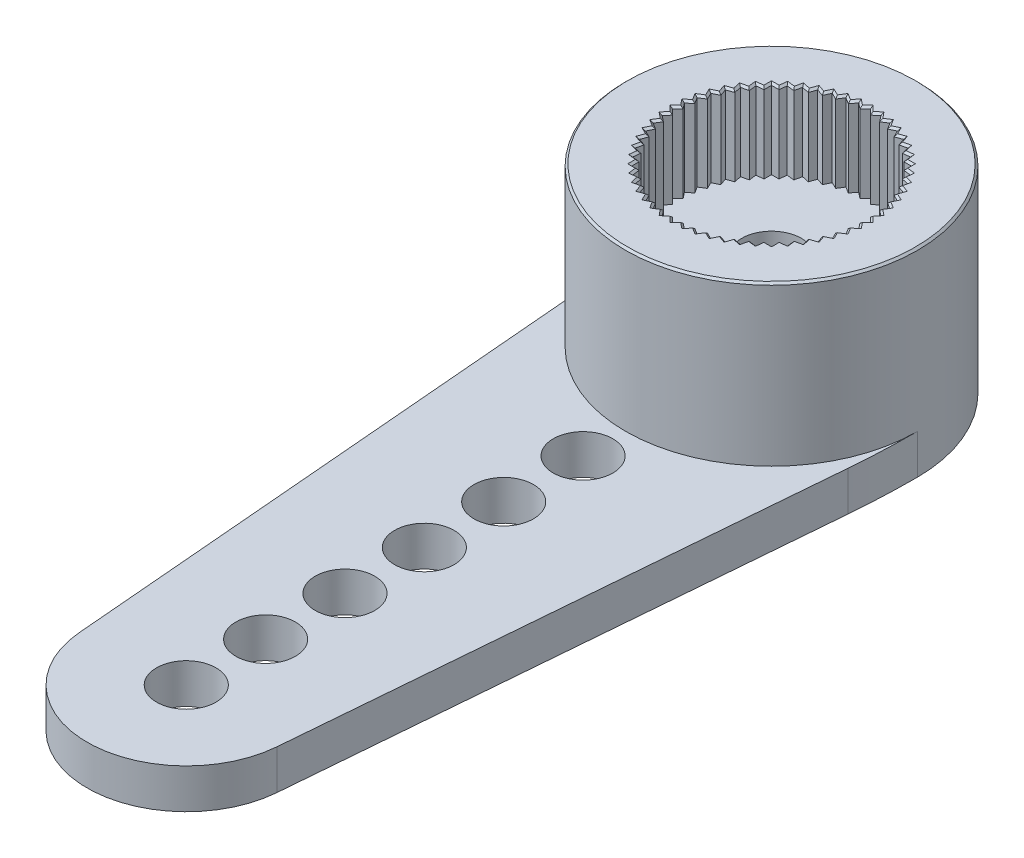
from build123d import *

# Parameters (mm, degrees)
SKETCH1_R           = 0.75
BOSS_EXTRUDE1_DEPTH = 1
SKETCH2_R           = 3.67931812
BOSS_EXTRUDE2_DEPTH = 5
SKETCH2_2_R         = 1.5
CUT_EXTRUDE1_DEPTH  = 0.5
SKETCH1_2_R         = 0.75
CUT_EXTRUDE4_DEPTH  = 19.333027078
SKETCH3_R           = 2.355
CUT_EXTRUDE5_DEPTH  = 2
CUT_EXTRUDE6_DEPTH  = 2
CIRPATTERN1_COUNT   = 56


with BuildPart() as part:
    # Sketch1 → Boss-Extrude1 (new body)
    with BuildSketch(Plane(origin=(0, 0, 0), x_dir=(1, 0, 0), z_dir=(0, 1, 0))):
        with BuildLine():
            Line((-3.608885156, -1.677008569), (-2.49119588, -14.959626071))
            ThreePointArc((-2.49119588, -14.959626071), (0, -17.25), (2.49119588, -14.959626071))
            Line((2.49119588, -14.959626071), (3.608885156, -1.677008569))
            ThreePointArc((3.608885156, -1.677008569), (3.661702121, -0.83924349), (3.67931812, 0))
            ThreePointArc((3.67931812, 0), (0, 3.67931812), (-3.67931812, 0))
            ThreePointArc((-3.67931812, 0), (-3.661702121, -0.83924349), (-3.608885156, -1.677008569))
        make_face()
        with Locations(Location((0, 0, 0), (0, 0, 270))):
            Circle(SKETCH1_R, mode=Mode.SUBTRACT)
        with Locations(Location((0, -4.75, 0), (0, 0, 90))):
            Circle(SKETCH1_R, mode=Mode.SUBTRACT)
        with Locations(Location((0, -6.75, 0), (0, 0, 90))):
            Circle(SKETCH1_R, mode=Mode.SUBTRACT)
        with Locations(Location((0, -8.75, 0), (0, 0, 90))):
            Circle(SKETCH1_R, mode=Mode.SUBTRACT)
        with Locations(Location((0, -10.75, 0), (0, 0, 90))):
            Circle(SKETCH1_R, mode=Mode.SUBTRACT)
        with Locations(Location((0, -12.75, 0), (0, 0, 90))):
            Circle(SKETCH1_R, mode=Mode.SUBTRACT)
        with Locations(Location((0, -14.75, 0), (0, 0, 90))):
            Circle(SKETCH1_R, mode=Mode.SUBTRACT)
    extrude(amount=BOSS_EXTRUDE1_DEPTH)

    # Sketch2 → Boss-Extrude2 (add)
    with BuildSketch(Plane.XZ):
        with Locations(Location((0, 0, 0), (0, 0, 270))):
            Circle(SKETCH2_R)
    extrude(amount=-BOSS_EXTRUDE2_DEPTH)

    # Sketch2<2> → Cut-Extrude1 (cut)
    with BuildSketch(Plane.XZ):
        with Locations(Location((0, 0, 0), (0, 0, 270))):
            Circle(SKETCH2_2_R)
    extrude(amount=-CUT_EXTRUDE1_DEPTH, mode=Mode.SUBTRACT)

    # Sketch1<2> → Cut-Extrude4 (cut, through all)
    with BuildSketch(Plane(origin=(0, 0, 0), x_dir=(1, 0, 0), z_dir=(0, 1, 0))):
        with Locations(Location((0, 0, 0), (0, 0, 90))):
            Circle(SKETCH1_2_R)
    extrude(amount=CUT_EXTRUDE4_DEPTH, mode=Mode.SUBTRACT)

    # Sketch3 → Cut-Extrude5 (cut)
    with BuildSketch(Plane(origin=(0, 5, 0), x_dir=(1, 0, 0), z_dir=(0, 1, 0))):
        with Locations(Location((0, 0, 0), (0, 0, 270))):
            Circle(SKETCH3_R)
    extrude(amount=-CUT_EXTRUDE5_DEPTH, mode=Mode.SUBTRACT)

    # Sketch4 → Cut-Extrude6 (cut)
    with BuildSketch(Plane(origin=(0, 5, 0), x_dir=(1, 0, 0), z_dir=(0, 1, 0))):
        with BuildLine():
            Line((0, 2.492171237), (-0.141421356, 2.35074988))
            ThreePointArc((-0.141421356, 2.35074988), (0, 2.355), (0.141421356, 2.35074988))
            Line((0.141421356, 2.35074988), (0, 2.492171237))
        make_face()
    cut_extrude6 = extrude(amount=-CUT_EXTRUDE6_DEPTH, mode=Mode.SUBTRACT)

    # CirPattern1: Cut-Extrude6 ×56 about axis
    cirpattern1_axis = Axis((0, 0, 0), (0, 1, 0))
    for i in range(1, CIRPATTERN1_COUNT):
        add(cut_extrude6.rotate(cirpattern1_axis, i * 360 / CIRPATTERN1_COUNT), mode=Mode.SUBTRACT)

    # Chamfer1: read off the stored shape, not the designer's step
    # Chamfer1 outline → Chamfer1 (revolve, cut)
    with BuildSketch(Plane.XY):
        Polygon((3.67931812, 5), (3.62931812, 5), (3.67931812, 4.95), align=None)
    revolve(axis=Axis((0, 0, 0), (0, 1, 0)), mode=Mode.SUBTRACT)

    # Chamfer1 2: loft between two sections, ruled curve by curve
    chamfer1_2_from = [
        Edge.make_line((0, 5, 2.562881915), (0.136275304, 5, 2.426606611)),
        Edge.make_line((2.426606611, 5, 0.136275304), (2.562881915, 5, 0)),
        Edge.make_line((0.136275304, 5, 2.426606611), (0.286951731, 5, 2.546767051)),
        Edge.make_line((-2.396090624, 5, 0.407112172), (-2.546767051, 5, 0.286951731)),
        Edge.make_line((0, 5, 2.562881915), (-0.136275304, 5, 2.426606611)),
        Edge.make_line((-2.426606611, 5, 0.136275304), (-2.562881915, 5, 0)),
        Edge.make_line((0.286951731, 5, 2.546767051), (0.407112172, 5, 2.396090624)),
        Edge.make_line((2.426606611, 5, -0.136275304), (2.546767051, 5, -0.286951731)),
        Edge.make_line((-0.136275304, 5, 2.426606611), (-0.286951731, 5, 2.546767051)),
        Edge.make_line((2.396090624, 5, 0.407112172), (2.546767051, 5, 0.286951731)),
        Edge.make_line((0.407112172, 5, 2.396090624), (0.570294877, 5, 2.498625114)),
        Edge.make_line((-2.335442409, 5, 0.672829367), (-2.498625114, 5, 0.570294877)),
        Edge.make_line((-0.286951731, 5, 2.546767051), (-0.407112172, 5, 2.396090624)),
        Edge.make_line((-2.426606611, 5, -0.136275304), (-2.546767051, 5, -0.286951731)),
        Edge.make_line((0.570294877, 5, 2.498625114), (0.672829367, 5, 2.335442409)),
        Edge.make_line((2.396090624, 5, -0.407112172), (2.498625114, 5, -0.570294877)),
        Edge.make_line((-0.407112172, 5, 2.396090624), (-0.570294877, 5, 2.498625114)),
        Edge.make_line((2.335442409, 5, 0.672829367), (2.498625114, 5, 0.570294877)),
        Edge.make_line((0.672829367, 5, 2.335442409), (0.846466235, 5, 2.419061517)),
        Edge.make_line((-2.245424649, 5, 0.930085343), (-2.419061517, 5, 0.846466235)),
        Edge.make_line((-0.570294877, 5, 2.498625114), (-0.672829367, 5, 2.335442409)),
        Edge.make_line((-2.396090624, 5, -0.407112172), (-2.498625114, 5, -0.570294877)),
        Edge.make_line((0.846466235, 5, 2.419061517), (0.930085343, 5, 2.245424649)),
        Edge.make_line((2.335442409, 5, -0.672829367), (2.419061517, 5, -0.846466235)),
        Edge.make_line((-0.672829367, 5, 2.335442409), (-0.846466235, 5, 2.419061517)),
        Edge.make_line((2.245424649, 5, 0.930085343), (2.419061517, 5, 0.846466235)),
        Edge.make_line((0.930085343, 5, 2.245424649), (1.111992788, 5, 2.309076817)),
        Edge.make_line((-2.127169372, 5, 1.175644956), (-2.309076817, 5, 1.111992788)),
        Edge.make_line((-0.846466235, 5, 2.419061517), (-0.930085343, 5, 2.245424649)),
        Edge.make_line((-2.335442409, 5, -0.672829367), (-2.419061517, 5, -0.846466235)),
        Edge.make_line((1.111992788, 5, 2.309076817), (1.175644956, 5, 2.127169372)),
        Edge.make_line((2.245424649, 5, -0.930085343), (2.309076817, 5, -1.111992788)),
        Edge.make_line((-0.930085343, 5, 2.245424649), (-1.111992788, 5, 2.309076817)),
        Edge.make_line((2.127169372, 5, 1.175644956), (2.309076817, 5, 1.111992788)),
        Edge.make_line((1.175644956, 5, 2.127169372), (1.363535387, 5, 2.170054137)),
        Edge.make_line((-1.982163706, 5, 1.406420152), (-2.170054137, 5, 1.363535387)),
        Edge.make_line((-1.111992788, 5, 2.309076817), (-1.175644956, 5, 2.127169372)),
        Edge.make_line((-2.245424649, 5, -0.930085343), (-2.309076817, 5, -1.111992788)),
        Edge.make_line((1.363535387, 5, 2.170054137), (1.406420152, 5, 1.982163706)),
        Edge.make_line((2.127169372, 5, -1.175644956), (2.170054137, 5, -1.363535387)),
        Edge.make_line((-1.175644956, 5, 2.127169372), (-1.363535387, 5, 2.170054137)),
        Edge.make_line((1.982163706, 5, 1.406420152), (2.170054137, 5, 1.363535387)),
        Edge.make_line((1.406420152, 5, 1.982163706), (1.597930737, 5, 2.003741767)),
        Edge.make_line((-1.812231181, 5, 1.619508798), (-2.003741767, 5, 1.597930737)),
        Edge.make_line((-1.363535387, 5, 2.170054137), (-1.406420152, 5, 1.982163706)),
        Edge.make_line((-2.127169372, 5, -1.175644956), (-2.170054137, 5, -1.363535387)),
        Edge.make_line((1.597930737, 5, 2.003741767), (1.619508798, 5, 1.812231181)),
        Edge.make_line((1.982163706, 5, -1.406420152), (2.003741767, 5, -1.597930737)),
        Edge.make_line((-1.406420152, 5, 1.982163706), (-1.597930737, 5, 2.003741767)),
        Edge.make_line((1.812231181, 5, 1.619508798), (2.003741767, 5, 1.597930737)),
        Edge.make_line((1.619508798, 5, 1.812231181), (1.812231181, 5, 1.812231181)),
        Edge.make_line((-1.619508798, 5, 1.812231181), (-1.812231181, 5, 1.812231181)),
        Edge.make_line((-1.597930737, 5, 2.003741767), (-1.619508798, 5, 1.812231181)),
        Edge.make_line((-1.982163706, 5, -1.406420152), (-2.003741767, 5, -1.597930737)),
        Edge.make_line((1.812231181, 5, 1.812231181), (1.812231181, 5, 1.619508798)),
        Edge.make_line((1.812231181, 5, -1.619508798), (1.812231181, 5, -1.812231181)),
        Edge.make_line((-1.812231181, 5, 1.812231181), (-1.812231181, 5, 1.619508798)),
        Edge.make_line((-1.812231181, 5, -1.619508798), (-1.812231181, 5, -1.812231181)),
        Edge.make_line((2.003741767, 5, 1.597930737), (1.982163706, 5, 1.406420152)),
        Edge.make_line((1.619508798, 5, -1.812231181), (1.597930737, 5, -2.003741767)),
        Edge.make_line((-2.003741767, 5, 1.597930737), (-1.982163706, 5, 1.406420152)),
        Edge.make_line((-1.619508798, 5, -1.812231181), (-1.597930737, 5, -2.003741767)),
        Edge.make_line((2.170054137, 5, 1.363535387), (2.127169372, 5, 1.175644956)),
        Edge.make_line((1.406420152, 5, -1.982163706), (1.363535387, 5, -2.170054137)),
        Edge.make_line((-2.170054137, 5, 1.363535387), (-2.127169372, 5, 1.175644956)),
        Edge.make_line((-1.406420152, 5, -1.982163706), (-1.363535387, 5, -2.170054137)),
        Edge.make_line((2.309076817, 5, 1.111992788), (2.245424649, 5, 0.930085343)),
        Edge.make_line((1.175644956, 5, -2.127169372), (1.111992788, 5, -2.309076817)),
        Edge.make_line((-2.309076817, 5, 1.111992788), (-2.245424649, 5, 0.930085343)),
        Edge.make_line((-1.175644956, 5, -2.127169372), (-1.111992788, 5, -2.309076817)),
        Edge.make_line((2.419061517, 5, 0.846466235), (2.335442409, 5, 0.672829367)),
        Edge.make_line((0.930085343, 5, -2.245424649), (0.846466235, 5, -2.419061517)),
        Edge.make_line((-2.419061517, 5, 0.846466235), (-2.335442409, 5, 0.672829367)),
        Edge.make_line((-0.930085343, 5, -2.245424649), (-0.846466235, 5, -2.419061517)),
        Edge.make_line((2.498625114, 5, 0.570294877), (2.396090624, 5, 0.407112172)),
        Edge.make_line((0.672829367, 5, -2.335442409), (0.570294877, 5, -2.498625114)),
        Edge.make_line((-2.498625114, 5, 0.570294877), (-2.396090624, 5, 0.407112172)),
        Edge.make_line((-0.672829367, 5, -2.335442409), (-0.570294877, 5, -2.498625114)),
        Edge.make_line((2.546767051, 5, 0.286951731), (2.426606611, 5, 0.136275304)),
        Edge.make_line((0.407112172, 5, -2.396090624), (0.286951731, 5, -2.546767051)),
        Edge.make_line((-2.546767051, 5, 0.286951731), (-2.426606611, 5, 0.136275304)),
        Edge.make_line((-0.407112172, 5, -2.396090624), (-0.286951731, 5, -2.546767051)),
        Edge.make_line((2.562881915, 5, 0), (2.426606611, 5, -0.136275304)),
        Edge.make_line((0.136275304, 5, -2.426606611), (0, 5, -2.562881915)),
        Edge.make_line((-2.562881915, 5, 0), (-2.426606611, 5, -0.136275304)),
        Edge.make_line((0, 5, -2.562881915), (-0.136275304, 5, -2.426606611)),
        Edge.make_line((2.546767051, 5, -0.286951731), (2.396090624, 5, -0.407112172)),
        Edge.make_line((-0.286951731, 5, -2.546767051), (-0.136275304, 5, -2.426606611)),
        Edge.make_line((-2.546767051, 5, -0.286951731), (-2.396090624, 5, -0.407112172)),
        Edge.make_line((0.286951731, 5, -2.546767051), (0.136275304, 5, -2.426606611)),
        Edge.make_line((2.498625114, 5, -0.570294877), (2.335442409, 5, -0.672829367)),
        Edge.make_line((-0.570294877, 5, -2.498625114), (-0.407112172, 5, -2.396090624)),
        Edge.make_line((-2.498625114, 5, -0.570294877), (-2.335442409, 5, -0.672829367)),
        Edge.make_line((0.570294877, 5, -2.498625114), (0.407112172, 5, -2.396090624)),
        Edge.make_line((2.419061517, 5, -0.846466235), (2.245424649, 5, -0.930085343)),
        Edge.make_line((-0.846466235, 5, -2.419061517), (-0.672829367, 5, -2.335442409)),
        Edge.make_line((-2.419061517, 5, -0.846466235), (-2.245424649, 5, -0.930085343)),
        Edge.make_line((0.846466235, 5, -2.419061517), (0.672829367, 5, -2.335442409)),
        Edge.make_line((2.309076817, 5, -1.111992788), (2.127169372, 5, -1.175644956)),
        Edge.make_line((-1.111992788, 5, -2.309076817), (-0.930085343, 5, -2.245424649)),
        Edge.make_line((-2.309076817, 5, -1.111992788), (-2.127169372, 5, -1.175644956)),
        Edge.make_line((1.111992788, 5, -2.309076817), (0.930085343, 5, -2.245424649)),
        Edge.make_line((2.170054137, 5, -1.363535387), (1.982163706, 5, -1.406420152)),
        Edge.make_line((-1.363535387, 5, -2.170054137), (-1.175644956, 5, -2.127169372)),
        Edge.make_line((-2.170054137, 5, -1.363535387), (-1.982163706, 5, -1.406420152)),
        Edge.make_line((1.363535387, 5, -2.170054137), (1.175644956, 5, -2.127169372)),
        Edge.make_line((2.003741767, 5, -1.597930737), (1.812231181, 5, -1.619508798)),
        Edge.make_line((-1.597930737, 5, -2.003741767), (-1.406420152, 5, -1.982163706)),
        Edge.make_line((-2.003741767, 5, -1.597930737), (-1.812231181, 5, -1.619508798)),
        Edge.make_line((1.597930737, 5, -2.003741767), (1.406420152, 5, -1.982163706)),
        Edge.make_line((1.812231181, 5, -1.812231181), (1.619508798, 5, -1.812231181)),
        Edge.make_line((-1.812231181, 5, -1.812231181), (-1.619508798, 5, -1.812231181)),
    ]
    chamfer1_2_to = [
        Edge.make_line((0, 4.95, 2.492171237), (0.132515428, 4.95, 2.359655809)),
        Edge.make_line((2.359655809, 4.95, 0.132515428), (2.492171237, 4.95, 0)),
        Edge.make_line((0.132515428, 4.95, 2.359655809), (0.279034647, 4.95, 2.476500987)),
        Edge.make_line((-2.329981768, 4.95, 0.395879825), (-2.476500987, 4.95, 0.279034647)),
        Edge.make_line((0, 4.95, 2.492171237), (-0.132515428, 4.95, 2.359655809)),
        Edge.make_line((-2.359655809, 4.95, 0.132515428), (-2.492171237, 4.95, 0)),
        Edge.make_line((0.279034647, 4.95, 2.476500987), (0.395879825, 4.95, 2.329981768)),
        Edge.make_line((2.359655809, 4.95, -0.132515428), (2.476500987, 4.95, -0.279034647)),
        Edge.make_line((-0.132515428, 4.95, 2.359655809), (-0.279034647, 4.95, 2.476500987)),
        Edge.make_line((2.329981768, 4.95, 0.395879825), (2.476500987, 4.95, 0.279034647)),
        Edge.make_line((0.395879825, 4.95, 2.329981768), (0.554560271, 4.95, 2.4296873)),
        Edge.make_line((-2.271006854, 4.95, 0.654265804), (-2.4296873, 4.95, 0.554560271)),
        Edge.make_line((-0.279034647, 4.95, 2.476500987), (-0.395879825, 4.95, 2.329981768)),
        Edge.make_line((-2.359655809, 4.95, -0.132515428), (-2.476500987, 4.95, -0.279034647)),
        Edge.make_line((0.554560271, 4.95, 2.4296873), (0.654265804, 4.95, 2.271006854)),
        Edge.make_line((2.329981768, 4.95, -0.395879825), (2.4296873, 4.95, -0.554560271)),
        Edge.make_line((-0.395879825, 4.95, 2.329981768), (-0.554560271, 4.95, 2.4296873)),
        Edge.make_line((2.271006854, 4.95, 0.654265804), (2.4296873, 4.95, 0.554560271)),
        Edge.make_line((0.654265804, 4.95, 2.271006854), (0.823111978, 4.95, 2.352318886)),
        Edge.make_line((-2.183472712, 4.95, 0.90442401), (-2.352318886, 4.95, 0.823111978)),
        Edge.make_line((-0.554560271, 4.95, 2.4296873), (-0.654265804, 4.95, 2.271006854)),
        Edge.make_line((-2.329981768, 4.95, -0.395879825), (-2.4296873, 4.95, -0.554560271)),
        Edge.make_line((0.823111978, 4.95, 2.352318886), (0.90442401, 4.95, 2.183472712)),
        Edge.make_line((2.271006854, 4.95, -0.654265804), (2.352318886, 4.95, -0.823111978)),
        Edge.make_line((-0.654265804, 4.95, 2.271006854), (-0.823111978, 4.95, 2.352318886)),
        Edge.make_line((2.183472712, 4.95, 0.90442401), (2.352318886, 4.95, 0.823111978)),
        Edge.make_line((0.90442401, 4.95, 2.183472712), (1.081312575, 4.95, 2.245368698)),
        Edge.make_line((-2.068480133, 4.95, 1.14320856), (-2.245368698, 4.95, 1.081312575)),
        Edge.make_line((-0.823111978, 4.95, 2.352318886), (-0.90442401, 4.95, 2.183472712)),
        Edge.make_line((-2.271006854, 4.95, -0.654265804), (-2.352318886, 4.95, -0.823111978)),
        Edge.make_line((1.081312575, 4.95, 2.245368698), (1.14320856, 4.95, 2.068480133)),
        Edge.make_line((2.183472712, 4.95, -0.90442401), (2.245368698, 4.95, -1.081312575)),
        Edge.make_line((-0.90442401, 4.95, 2.183472712), (-1.081312575, 4.95, 2.245368698)),
        Edge.make_line((2.068480133, 4.95, 1.14320856), (2.245368698, 4.95, 1.081312575)),
        Edge.make_line((1.14320856, 4.95, 2.068480133), (1.325915038, 4.95, 2.110181695)),
        Edge.make_line((-1.927475217, 4.95, 1.367616599), (-2.110181695, 4.95, 1.325915038)),
        Edge.make_line((-1.081312575, 4.95, 2.245368698), (-1.14320856, 4.95, 2.068480133)),
        Edge.make_line((-2.183472712, 4.95, -0.90442401), (-2.245368698, 4.95, -1.081312575)),
        Edge.make_line((1.325915038, 4.95, 2.110181695), (1.367616599, 4.95, 1.927475217)),
        Edge.make_line((2.068480133, 4.95, -1.14320856), (2.110181695, 4.95, -1.325915038)),
        Edge.make_line((-1.14320856, 4.95, 2.068480133), (-1.325915038, 4.95, 2.110181695)),
        Edge.make_line((1.927475217, 4.95, 1.367616599), (2.110181695, 4.95, 1.325915038)),
        Edge.make_line((1.367616599, 4.95, 1.927475217), (1.553843351, 4.95, 1.948457932)),
        Edge.make_line((-1.762231181, 4.95, 1.574826066), (-1.948457932, 4.95, 1.553843351)),
        Edge.make_line((-1.325915038, 4.95, 2.110181695), (-1.367616599, 4.95, 1.927475217)),
        Edge.make_line((-2.068480133, 4.95, -1.14320856), (-2.110181695, 4.95, -1.325915038)),
        Edge.make_line((1.553843351, 4.95, 1.948457932), (1.574826066, 4.95, 1.762231181)),
        Edge.make_line((1.927475217, 4.95, -1.367616599), (1.948457932, 4.95, -1.553843351)),
        Edge.make_line((-1.367616599, 4.95, 1.927475217), (-1.553843351, 4.95, 1.948457932)),
        Edge.make_line((1.762231181, 4.95, 1.574826066), (1.948457932, 4.95, 1.553843351)),
        Edge.make_line((1.574826066, 4.95, 1.762231181), (1.762231181, 4.95, 1.762231181)),
        Edge.make_line((-1.574826066, 4.95, 1.762231181), (-1.762231181, 4.95, 1.762231181)),
        Edge.make_line((-1.553843351, 4.95, 1.948457932), (-1.574826066, 4.95, 1.762231181)),
        Edge.make_line((-1.927475217, 4.95, -1.367616599), (-1.948457932, 4.95, -1.553843351)),
        Edge.make_line((1.762231181, 4.95, 1.762231181), (1.762231181, 4.95, 1.574826066)),
        Edge.make_line((1.762231181, 4.95, -1.574826066), (1.762231181, 4.95, -1.762231181)),
        Edge.make_line((-1.762231181, 4.95, 1.762231181), (-1.762231181, 4.95, 1.574826066)),
        Edge.make_line((-1.762231181, 4.95, -1.574826066), (-1.762231181, 4.95, -1.762231181)),
        Edge.make_line((1.948457932, 4.95, 1.553843351), (1.927475217, 4.95, 1.367616599)),
        Edge.make_line((1.574826066, 4.95, -1.762231181), (1.553843351, 4.95, -1.948457932)),
        Edge.make_line((-1.948457932, 4.95, 1.553843351), (-1.927475217, 4.95, 1.367616599)),
        Edge.make_line((-1.574826066, 4.95, -1.762231181), (-1.553843351, 4.95, -1.948457932)),
        Edge.make_line((2.110181695, 4.95, 1.325915038), (2.068480133, 4.95, 1.14320856)),
        Edge.make_line((1.367616599, 4.95, -1.927475217), (1.325915038, 4.95, -2.110181695)),
        Edge.make_line((-2.110181695, 4.95, 1.325915038), (-2.068480133, 4.95, 1.14320856)),
        Edge.make_line((-1.367616599, 4.95, -1.927475217), (-1.325915038, 4.95, -2.110181695)),
        Edge.make_line((2.245368698, 4.95, 1.081312575), (2.183472712, 4.95, 0.90442401)),
        Edge.make_line((1.14320856, 4.95, -2.068480133), (1.081312575, 4.95, -2.245368698)),
        Edge.make_line((-2.245368698, 4.95, 1.081312575), (-2.183472712, 4.95, 0.90442401)),
        Edge.make_line((-1.14320856, 4.95, -2.068480133), (-1.081312575, 4.95, -2.245368698)),
        Edge.make_line((2.352318886, 4.95, 0.823111978), (2.271006854, 4.95, 0.654265804)),
        Edge.make_line((0.90442401, 4.95, -2.183472712), (0.823111978, 4.95, -2.352318886)),
        Edge.make_line((-2.352318886, 4.95, 0.823111978), (-2.271006854, 4.95, 0.654265804)),
        Edge.make_line((-0.90442401, 4.95, -2.183472712), (-0.823111978, 4.95, -2.352318886)),
        Edge.make_line((2.4296873, 4.95, 0.554560271), (2.329981768, 4.95, 0.395879825)),
        Edge.make_line((0.654265804, 4.95, -2.271006854), (0.554560271, 4.95, -2.4296873)),
        Edge.make_line((-2.4296873, 4.95, 0.554560271), (-2.329981768, 4.95, 0.395879825)),
        Edge.make_line((-0.654265804, 4.95, -2.271006854), (-0.554560271, 4.95, -2.4296873)),
        Edge.make_line((2.476500987, 4.95, 0.279034647), (2.359655809, 4.95, 0.132515428)),
        Edge.make_line((0.395879825, 4.95, -2.329981768), (0.279034647, 4.95, -2.476500987)),
        Edge.make_line((-2.476500987, 4.95, 0.279034647), (-2.359655809, 4.95, 0.132515428)),
        Edge.make_line((-0.395879825, 4.95, -2.329981768), (-0.279034647, 4.95, -2.476500987)),
        Edge.make_line((2.492171237, 4.95, 0), (2.359655809, 4.95, -0.132515428)),
        Edge.make_line((0.132515428, 4.95, -2.359655809), (0, 4.95, -2.492171237)),
        Edge.make_line((-2.492171237, 4.95, 0), (-2.359655809, 4.95, -0.132515428)),
        Edge.make_line((0, 4.95, -2.492171237), (-0.132515428, 4.95, -2.359655809)),
        Edge.make_line((2.476500987, 4.95, -0.279034647), (2.329981768, 4.95, -0.395879825)),
        Edge.make_line((-0.279034647, 4.95, -2.476500987), (-0.132515428, 4.95, -2.359655809)),
        Edge.make_line((-2.476500987, 4.95, -0.279034647), (-2.329981768, 4.95, -0.395879825)),
        Edge.make_line((0.279034647, 4.95, -2.476500987), (0.132515428, 4.95, -2.359655809)),
        Edge.make_line((2.4296873, 4.95, -0.554560271), (2.271006854, 4.95, -0.654265804)),
        Edge.make_line((-0.554560271, 4.95, -2.4296873), (-0.395879825, 4.95, -2.329981768)),
        Edge.make_line((-2.4296873, 4.95, -0.554560271), (-2.271006854, 4.95, -0.654265804)),
        Edge.make_line((0.554560271, 4.95, -2.4296873), (0.395879825, 4.95, -2.329981768)),
        Edge.make_line((2.352318886, 4.95, -0.823111978), (2.183472712, 4.95, -0.90442401)),
        Edge.make_line((-0.823111978, 4.95, -2.352318886), (-0.654265804, 4.95, -2.271006854)),
        Edge.make_line((-2.352318886, 4.95, -0.823111978), (-2.183472712, 4.95, -0.90442401)),
        Edge.make_line((0.823111978, 4.95, -2.352318886), (0.654265804, 4.95, -2.271006854)),
        Edge.make_line((2.245368698, 4.95, -1.081312575), (2.068480133, 4.95, -1.14320856)),
        Edge.make_line((-1.081312575, 4.95, -2.245368698), (-0.90442401, 4.95, -2.183472712)),
        Edge.make_line((-2.245368698, 4.95, -1.081312575), (-2.068480133, 4.95, -1.14320856)),
        Edge.make_line((1.081312575, 4.95, -2.245368698), (0.90442401, 4.95, -2.183472712)),
        Edge.make_line((2.110181695, 4.95, -1.325915038), (1.927475217, 4.95, -1.367616599)),
        Edge.make_line((-1.325915038, 4.95, -2.110181695), (-1.14320856, 4.95, -2.068480133)),
        Edge.make_line((-2.110181695, 4.95, -1.325915038), (-1.927475217, 4.95, -1.367616599)),
        Edge.make_line((1.325915038, 4.95, -2.110181695), (1.14320856, 4.95, -2.068480133)),
        Edge.make_line((1.948457932, 4.95, -1.553843351), (1.762231181, 4.95, -1.574826066)),
        Edge.make_line((-1.553843351, 4.95, -1.948457932), (-1.367616599, 4.95, -1.927475217)),
        Edge.make_line((-1.948457932, 4.95, -1.553843351), (-1.762231181, 4.95, -1.574826066)),
        Edge.make_line((1.553843351, 4.95, -1.948457932), (1.367616599, 4.95, -1.927475217)),
        Edge.make_line((1.762231181, 4.95, -1.762231181), (1.574826066, 4.95, -1.762231181)),
        Edge.make_line((-1.762231181, 4.95, -1.762231181), (-1.574826066, 4.95, -1.762231181)),
    ]
    chamfer1_2 = Solid(Shell([*[Face.make_surface_from_curves(chamfer1_2_from[k], chamfer1_2_to[k]) for k in range(112)], Face(Wire(chamfer1_2_from)), Face(Wire(chamfer1_2_to))]))
    add(chamfer1_2, mode=Mode.SUBTRACT)


solid = part.part
